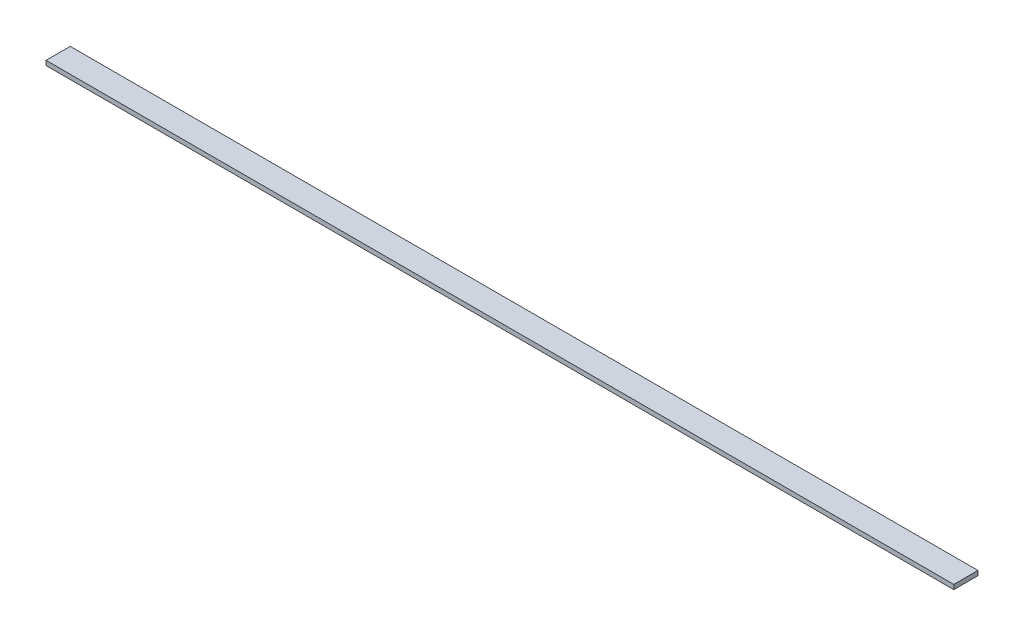
from build123d import *

# Parameters (mm, degrees)
SKIZZE1_W                       = 1500
SKIZZE1_H                       = 40
AUFSATZ_LINEAR_AUSTRAGEN1_DEPTH = 7.5


with BuildPart() as part:
    # Skizze1 → Aufsatz-Linear austragen1 (new body)
    with BuildSketch(Plane(origin=(0, 0, 0), x_dir=(1, 0, 0), z_dir=(0, 1, 0))):
        Rectangle(SKIZZE1_W, SKIZZE1_H)
    extrude(amount=AUFSATZ_LINEAR_AUSTRAGEN1_DEPTH)


solid = part.part
